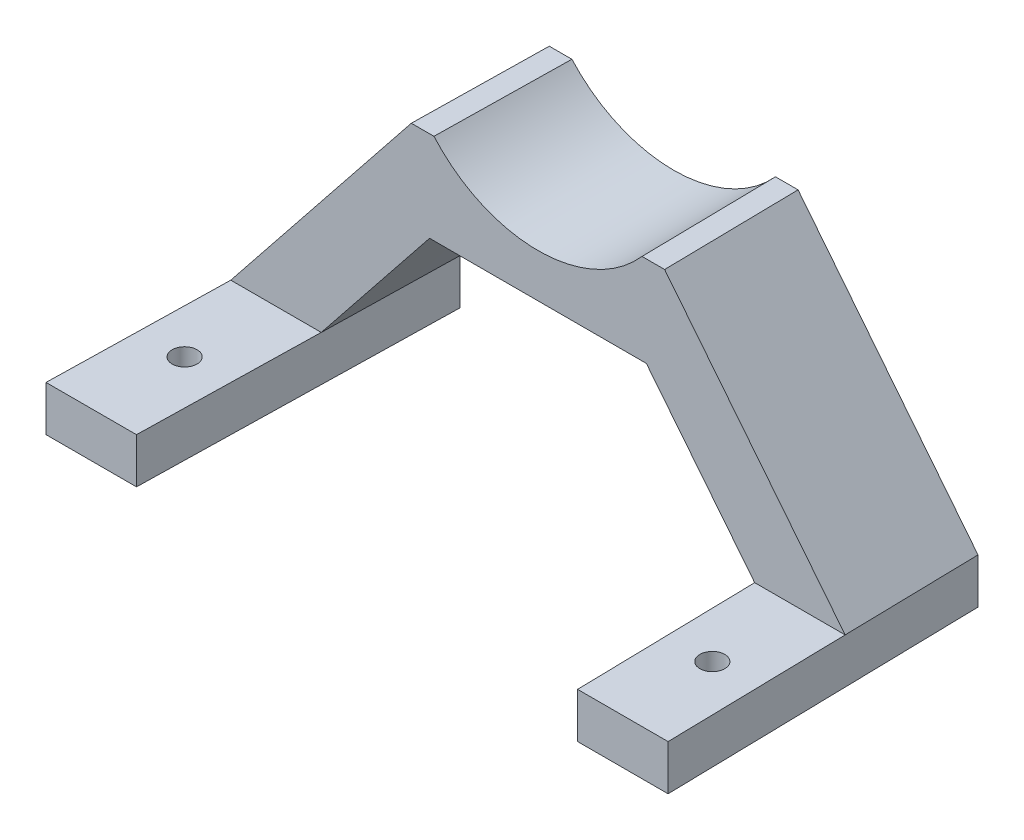
from build123d import *

# Parameters (mm, degrees)
SKETCH1_R             = 2.75
BOSS_EXTRUDE1_DEPTH   = 10
BOSS_EXTRUDE1_2_DEPTH = 10


with BuildPart() as part:
    # Sketch1 → Boss-Extrude1 (new body)
    with BuildSketch(Plane(origin=(0, 0, 0), x_dir=(1, 0, 0), z_dir=(0, 1, 0))):
        Polygon((0, 0), (20.004497681, 0), (21.489122754, 70), (1.484625073, 70), align=None)
        with Locations((10.430924608, 20.212041611)):
            Circle(SKETCH1_R, mode=Mode.SUBTRACT)
    extrude(amount=BOSS_EXTRUDE1_DEPTH)



with BuildPart() as body_2:
    # Sketch1 → Boss-Extrude1 2 (new body)
    with BuildSketch(Plane(origin=(0, 0, 0), x_dir=(1, 0, 0), z_dir=(0, 1, 0))):
        Polygon((116.0383729, 70), (136.042870581, 70), (137.527495654, 0), (117.522997972, 0), align=None)
        with Locations((127.096571045, 20.212041611)):
            Circle(SKETCH1_R, mode=Mode.SUBTRACT)
    extrude(amount=BOSS_EXTRUDE1_2_DEPTH)


with BuildPart() as part_1:
    add(part.part)

    add(body_2.part)  # Loft1 merges body 2
    # Sketch2 for Loft1 → Loft1 section 0
    with BuildSketch(Plane(origin=(0, 0, -70), x_dir=(-1, 0, 0), z_dir=(0, 0, -1))):
        with BuildLine():
            Line((-91.263747827, 60.005), (-96.263747827, 60.005))
            Line((-96.263747827, 60.005), (-136.042870581, 10))
            Line((-136.042870581, 10), (-116.0383729, 10))
            Line((-116.0383729, 10), (-92.173285756, 40))
            Line((-92.173285756, 40), (-45.354209898, 40))
            Line((-45.354209898, 40), (-21.489122754, 10))
            Line((-21.489122754, 10), (-1.484625073, 10))
            Line((-1.484625073, 10), (-41.263747827, 60.005))
            Line((-41.263747827, 60.005), (-46.263747827, 60.005))
            # circular arc as an exact rational Bezier (weights 1, cos(half-angle), 1)
            Bezier((-46.263747827, 60.005), (-68.763747827, 35.063320513), (-91.263747827, 60.005), weights=[1, 0.669827588, 1])
        make_face()
    # Sketch3 for Loft1 → Loft1 section 1
    with BuildSketch(Plane(origin=(0, 0, -40), x_dir=(-1, 0, 0), z_dir=(0, 0, -1))):
        with BuildLine():
            Line((-136.679138469, 10), (-96.763747827, 60.005))
            Line((-96.763747827, 60.005), (-91.763747827, 60.005))
            Bezier((-91.763747827, 60.005), (-68.763747827, 33.942484546), (-45.763747827, 60.005), weights=[1, 0.661680883, 1])
            Line((-45.763747827, 60.005), (-40.763747827, 60.005))
            Line((-40.763747827, 60.005), (-0.848357184, 10))
            Line((-0.848357184, 10), (-20.852854866, 10))
            Line((-20.852854866, 10), (-44.799694567, 40))
            Line((-44.799694567, 40), (-92.727801087, 40))
            Line((-92.727801087, 40), (-116.674640788, 10))
            Line((-116.674640788, 10), (-136.679138469, 10))
        make_face()
    loft()


solid = part_1.part
